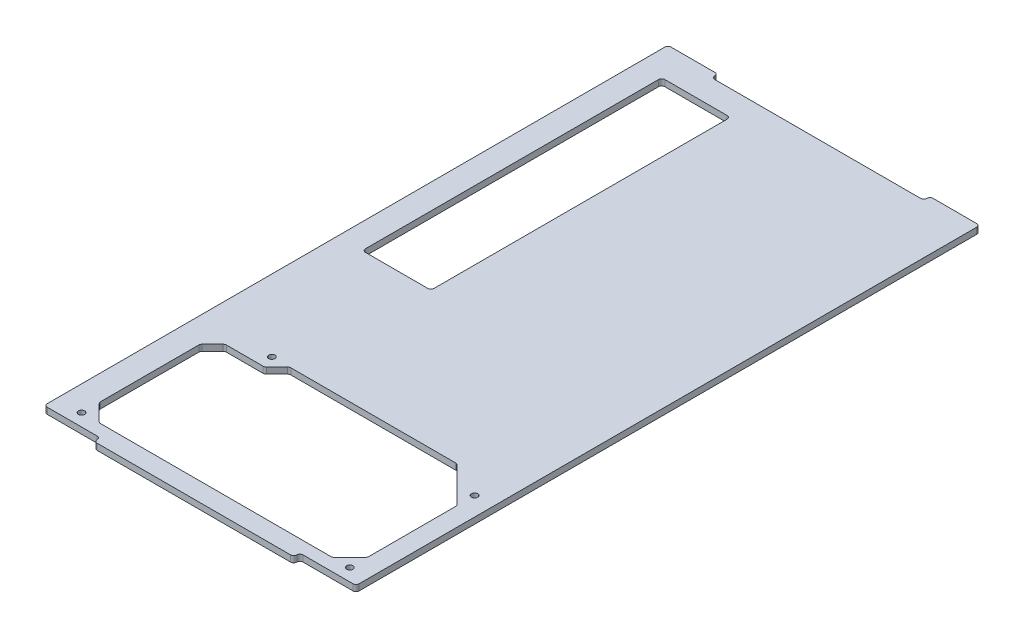
from build123d import *

# Parameters (mm, degrees)
BOSS_EXTRUDE1_DEPTH = 3.175
SKETCH2_W           = 107.95
SKETCH2_H           = 3.175
CUT_EXTRUDE1_DEPTH  = 355.989990176
SKETCH3_R           = 1.5875
CUT_EXTRUDE2_DEPTH  = 355.989990176
SKETCH4_W           = 34.925
SKETCH4_H           = 152.4
CUT_EXTRUDE3_DEPTH  = 355.989990176
FILLET1_R           = 1.5875


with BuildPart() as part:
    # Sketch1 → Boss-Extrude1 (new body)
    with BuildSketch(Plane(origin=(0, 0, 0), x_dir=(1, 0, 0), z_dir=(0, 1, 0))):
        Polygon((130.175, 0), (158.75, 0), (158.75, 317.5), (0, 317.5), (0, 0), (28.575, 0), (28.575, -3.175), (130.175, -3.175), align=None)
    extrude(amount=BOSS_EXTRUDE1_DEPTH)

    # Sketch2 → Cut-Extrude1 (cut, through all)
    with BuildSketch(Plane(origin=(0, 3.175, 0), x_dir=(1, 0, 0), z_dir=(0, 1, 0))):
        with Locations((79.375, 315.9125)):
            Rectangle(SKETCH2_W, SKETCH2_H)
    extrude(amount=-CUT_EXTRUDE1_DEPTH, mode=Mode.SUBTRACT)

    # Sketch3 → Cut-Extrude2 (cut, through all)
    with BuildSketch(Plane(origin=(0, 3.175, 0), x_dir=(1, 0, 0), z_dir=(0, 1, 0))):
        with Locations(Location((12.7, 6.35, 0), (0, 0, 270))):
            Circle(SKETCH3_R)
        with Locations(Location((149.225, 6.35, 0), (0, 0, 270))):
            Circle(SKETCH3_R)
        with Locations(Location((149.225, 69.85, 0), (0, 0, 270))):
            Circle(SKETCH3_R)
        with Locations(Location((36.5125, 79.375, 0), (0, 0, 270))):
            Circle(SKETCH3_R)
        Polygon((21.680256121, 6.35), (12.7, 15.330256121), (12.7, 66.675), (19.05, 73.025), (39.142756121, 73.025), (45.492756121, 79.375), (130.719743879, 79.375), (149.225, 60.869743879), (149.225, 15.330256121), (140.244743879, 6.35), align=None)
    extrude(amount=-CUT_EXTRUDE2_DEPTH, mode=Mode.SUBTRACT)

    # Sketch4 → Cut-Extrude3 (cut, through all)
    with BuildSketch(Plane(origin=(0, 3.175, 0), x_dir=(1, 0, 0), z_dir=(0, 1, 0))):
        with Locations((30.1625, 225.425)):
            Rectangle(SKETCH4_W, SKETCH4_H)
    extrude(amount=-CUT_EXTRUDE3_DEPTH, mode=Mode.SUBTRACT)

    # Fillet1
    fillet1_edges = [part.edges().sort_by_distance(p)[0] for p in [
        (25.4, 1.5875, -314.325),
        (25.4, 1.5875, -317.5),
        (0, 1.5875, -317.5),
        (0, 1.5875, 0),
        (28.575, 1.5875, 0),
        (28.575, 1.5875, 3.175),
        (130.175, 1.5875, 3.175),
        (130.175, 1.5875, 0),
        (158.75, 1.5875, 0),
        (158.75, 1.5875, -317.5),
        (133.35, 1.5875, -317.5),
        (133.35, 1.5875, -314.325),
        (140.244743879, 1.5875, -6.35),
        (149.225, 1.5875, -15.330256121),
        (149.225, 1.5875, -60.869743879),
        (130.719743879, 1.5875, -79.375),
        (45.492756121, 1.5875, -79.375),
        (39.142756121, 1.5875, -73.025),
        (19.05, 1.5875, -73.025),
        (12.7, 1.5875, -66.675),
        (21.680256121, 1.5875, -6.35),
        (12.7, 1.5875, -15.330256121),
        (12.7, 1.5875, -149.225),
        (47.625, 1.5875, -149.225),
        (12.7, 1.5875, -301.625),
        (47.625, 1.5875, -301.625),
    ]]
    fillet(fillet1_edges, radius=FILLET1_R - 0.0001)  # a hair under: the kernel refuses the full size


solid = part.part
